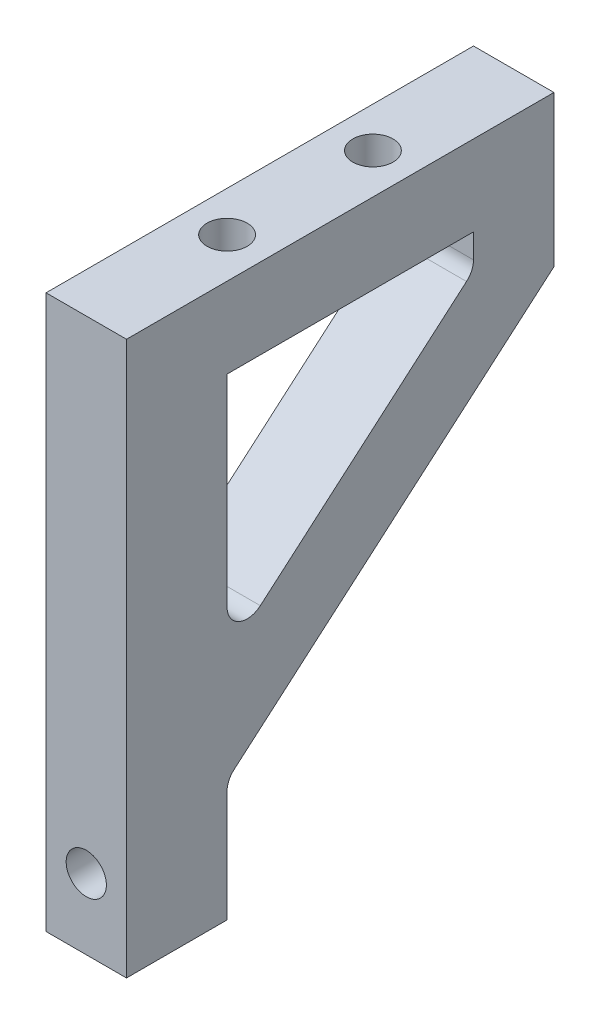
from build123d import *

# Parameters (mm, degrees)
EXTRUDE_1_DEPTH     = 4
CUT_EXTRUDE_1_REACH = 71.622
SKETCH_2_R          = 2
CUT_EXTRUDE_3_REACH = 66.01
SKETCH_4_R          = 2
FILLET_1_R          = 2
CHAMFER_1_SIZE      = 2


with BuildPart() as part:
    # 草图1 → 凸台-拉伸1 (new, symmetric)
    with BuildSketch(Plane(origin=(0, 0, 0), x_dir=(0, 0, -1), z_dir=(1, 0, 0))):
        Polygon((0, 0), (42.5, 0), (42.5, -15), (10, -43), (10, -55), (0, -55), align=None)
        Polygon((10, -32.440459038), (34.5, -11.33276673), (34.5, -8), (10, -8), align=None, mode=Mode.SUBTRACT)
    extrude(amount=EXTRUDE_1_DEPTH, both=True)

    # 草图2 → 切除-拉伸1 (cut, up to next)
    with BuildSketch(Plane(origin=(0, 0, 0), x_dir=(1, 0, 0), z_dir=(0, 1, 0)), mode=Mode.PRIVATE) as cut_extrude_1_sk1:
        with Locations(Location((0, 14, 0), (0, 0, 270))):
            Circle(SKETCH_2_R)
    cut_extrude_1_tool1 = extrude(cut_extrude_1_sk1.sketch, amount=-CUT_EXTRUDE_1_REACH, mode=Mode.PRIVATE) & part.part
    # 草图2 → 切除-拉伸1 (cut, up to next)
    with BuildSketch(Plane(origin=(0, 0, 0), x_dir=(1, 0, 0), z_dir=(0, 1, 0)), mode=Mode.PRIVATE) as cut_extrude_1_sk2:
        with Locations(Location((0, 28.5, 0), (0, 0, 270))):
            Circle(SKETCH_2_R)
    cut_extrude_1_tool2 = extrude(cut_extrude_1_sk2.sketch, amount=-CUT_EXTRUDE_1_REACH, mode=Mode.PRIVATE) & part.part
    add(cut_extrude_1_tool1.solids().sort_by_distance((0, 0, -14))[0], mode=Mode.SUBTRACT)
    add(cut_extrude_1_tool2.solids().sort_by_distance((0, 0, -28.5))[0], mode=Mode.SUBTRACT)

    # 草图4 → 切除-拉伸3 (cut, up to next)
    with BuildSketch(Plane(origin=(0, 0, -10), x_dir=(-1, 0, 0), z_dir=(0, 0, -1)), mode=Mode.PRIVATE) as cut_extrude_3_sk1:
        with Locations(Location((0, -48, 0), (0, 0, 90))):
            Circle(SKETCH_4_R)
    cut_extrude_3_tool1 = extrude(cut_extrude_3_sk1.sketch, amount=-CUT_EXTRUDE_3_REACH, mode=Mode.PRIVATE) & part.part
    add(cut_extrude_3_tool1.solids().sort_by_distance((0, -48, -10))[0], mode=Mode.SUBTRACT)

    # 圆角1
    fillet_1_edges = [part.edges().sort_by_distance(p)[0] for p in [
        (0, -43, -10),
        (0, -32.440459038, -10),
        (0, -11.33276673, -34.5),
    ]]
    fillet(fillet_1_edges, radius=FILLET_1_R)

    # 倒角1
    chamfer_1_edges = [part.edges().sort_by_distance(p)[0] for p in [
        (0, -50, -10),
    ]]
    chamfer(chamfer_1_edges, length=CHAMFER_1_SIZE - 0.0001)  # a hair under: the kernel refuses the full size


solid = part.part
